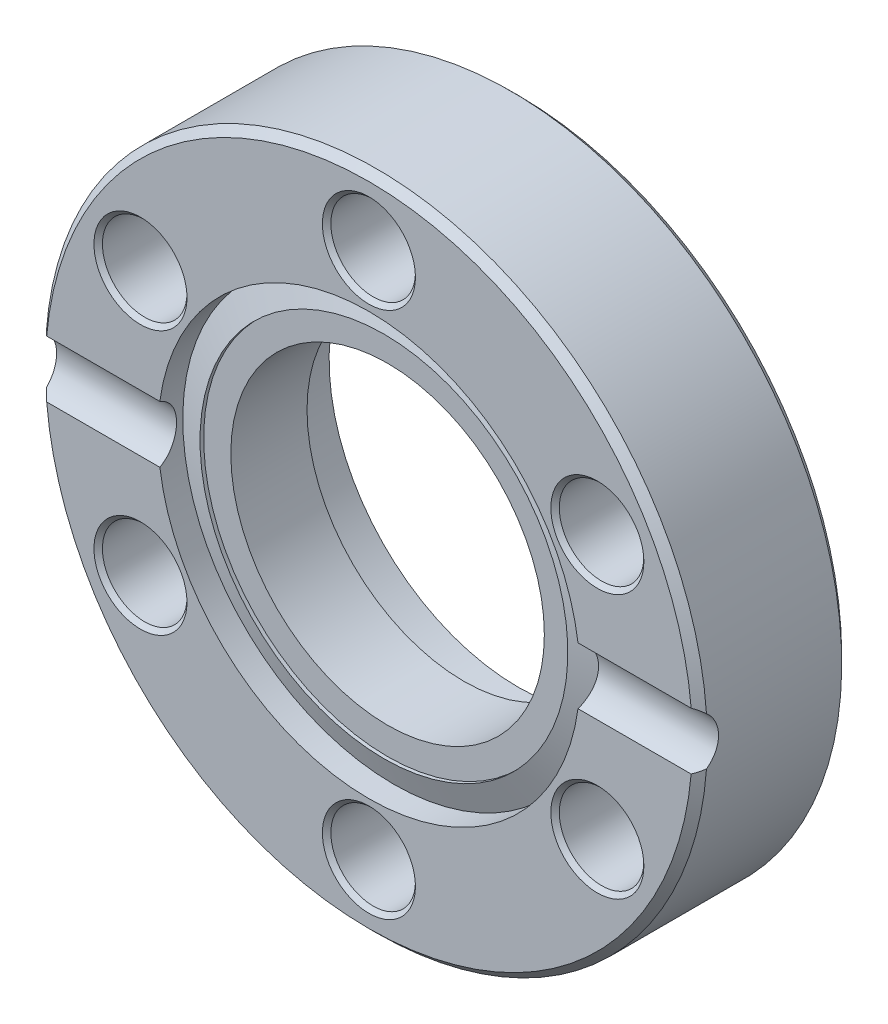
from build123d import *

# Parameters (mm, degrees)
SKETCH4_R          = 2.159
CUT_EXTRUDE1_DEPTH = 26.073415443
CUT_EXTRUDE2_START = 10.670865
SKETCH5_R          = 1.5875
CUT_EXTRUDE2_DEPTH = 6.220135


# Read off the part's stored shape, not the designer's step: Mirror2
with BuildPart() as part:
    # Sketch3 → Revolve1 (revolve)
    with BuildSketch(Plane(origin=(0, 0, 0), x_dir=(0, 0, -1), z_dir=(1, 0, 0)), mode=Mode.PRIVATE) as revolve1_sk:
        Polygon((-3.81, 16.51), (-3.81, 10.7696), (-2.54, 10.7696), (-3.043843995, 9.3853), (-2.8575, 9.3853), (-2.8575, 8.001), (1.031875, 8.001), (1.031875, 9.652), (3.81, 9.652), (3.81, 16.51), (3.429, 16.891), (-3.429, 16.891), align=None)
    revolve(revolve1_sk.sketch.rotate(Axis((0, 0, 3.81), (0, 0, -1)), 180), axis=Axis((0, 0, 3.81), (0, 0, -1)))

    # Sketch4 → Cut-Extrude1 (cut, through all)
    with BuildSketch(Plane.XY.offset(3.81)):
        with Locations((0, 13.462)):
            Circle(SKETCH4_R)
        with Locations((11.658433986, 6.731)):
            Circle(SKETCH4_R)
        with Locations((11.658433986, -6.731)):
            Circle(SKETCH4_R)
        with Locations((0, -13.462)):
            Circle(SKETCH4_R)
        with Locations((-11.658433986, -6.731)):
            Circle(SKETCH4_R)
        with Locations((-11.658433986, 6.731)):
            Circle(SKETCH4_R)
    extrude(amount=-CUT_EXTRUDE1_DEPTH, mode=Mode.SUBTRACT)

    # Sketch5 → Cut-Extrude2 (cut)
    with BuildSketch(Plane(origin=(0, 0, 0), x_dir=(0, 0, -1), z_dir=(1, 0, 0)).offset(CUT_EXTRUDE2_START)):
        with Locations((-4.445, 0)):
            Circle(SKETCH5_R)
    cut_extrude2 = extrude(amount=CUT_EXTRUDE2_DEPTH, mode=Mode.SUBTRACT)

    # Mirror1: Cut-Extrude2 across plane
    add(cut_extrude2.mirror(Plane(origin=(0, 0, 0), x_dir=(0, 0, 1), z_dir=(1, 0, 0))), mode=Mode.SUBTRACT)

    # Cut-Extrude3 cone 1 section (through the dimple's axis) → Cut-Extrude3 (revolve, cut)
    with BuildSketch(Plane(origin=(0, 13.462, 3.81), x_dir=(0, -1, 0), z_dir=(1, 0, 0))):
        Polygon((0, 0), (2.3749, 0), (0, 2.3749), align=None)
    revolve(axis=Axis((0, 13.462, 3.81), (0, 0, -1)), mode=Mode.SUBTRACT)

    # Cut-Extrude3 cone 2 section (through the dimple's axis) → Cut-Extrude3 cone 2 (revolve, cut)
    with BuildSketch(Plane(origin=(11.658433986, 6.731, 3.81), x_dir=(0, -1, 0), z_dir=(1, 0, 0))):
        Polygon((0, 0), (2.3749, 0), (0, 2.3749), align=None)
    revolve(axis=Axis((11.658433986, 6.731, 3.81), (0, 0, -1)), mode=Mode.SUBTRACT)

    # Cut-Extrude3 cone 3 section (through the dimple's axis) → Cut-Extrude3 cone 3 (revolve, cut)
    with BuildSketch(Plane(origin=(11.658433986, -6.731, 3.81), x_dir=(0, -1, 0), z_dir=(1, 0, 0))):
        Polygon((0, 0), (2.3749, 0), (0, 2.3749), align=None)
    revolve(axis=Axis((11.658433986, -6.731, 3.81), (0, 0, -1)), mode=Mode.SUBTRACT)

    # Cut-Extrude3 cone 4 section (through the dimple's axis) → Cut-Extrude3 cone 4 (revolve, cut)
    with BuildSketch(Plane(origin=(0, -13.462, 3.81), x_dir=(0, -1, 0), z_dir=(1, 0, 0))):
        Polygon((0, 0), (2.3749, 0), (0, 2.3749), align=None)
    revolve(axis=Axis((0, -13.462, 3.81), (0, 0, -1)), mode=Mode.SUBTRACT)

    # Cut-Extrude3 cone 5 section (through the dimple's axis) → Cut-Extrude3 cone 5 (revolve, cut)
    with BuildSketch(Plane(origin=(-11.658433986, -6.731, 3.81), x_dir=(0, -1, 0), z_dir=(1, 0, 0))):
        Polygon((0, 0), (2.3749, 0), (0, 2.3749), align=None)
    revolve(axis=Axis((-11.658433986, -6.731, 3.81), (0, 0, -1)), mode=Mode.SUBTRACT)

    # Cut-Extrude3 cone 6 section (through the dimple's axis) → Cut-Extrude3 cone 6 (revolve, cut)
    with BuildSketch(Plane(origin=(-11.658433986, 6.731, 3.81), x_dir=(0, -1, 0), z_dir=(1, 0, 0))):
        Polygon((0, 0), (2.3749, 0), (0, 2.3749), align=None)
    revolve(axis=Axis((-11.658433986, 6.731, 3.81), (0, 0, -1)), mode=Mode.SUBTRACT)

    # Mirror2 outline → Mirror2 (revolve, cut)
    with BuildSketch(Plane.XZ.offset(-13.462)):
        Polygon((2.3749, -3.81), (2.159, -3.5941), (2.159, -3.81), align=None)
    revolve(axis=Axis((0, 13.462, 0), (0, 0, 1)), mode=Mode.SUBTRACT)

    # Mirror2 2 outline → Mirror2 2 (revolve, cut)
    with BuildSketch(Plane(origin=(-11.658433986, 6.731, 0), x_dir=(1, 0, 0), z_dir=(0, -1, 0))):
        Polygon((2.3749, -3.81), (2.159, -3.5941), (2.159, -3.81), align=None)
    revolve(axis=Axis((-11.658433986, 6.731, 0), (0, 0, 1)), mode=Mode.SUBTRACT)

    # Mirror2 3 outline → Mirror2 3 (revolve, cut)
    with BuildSketch(Plane(origin=(-11.658433986, -6.731, 0), x_dir=(1, 0, 0), z_dir=(0, -1, 0))):
        Polygon((2.3749, -3.81), (2.159, -3.5941), (2.159, -3.81), align=None)
    revolve(axis=Axis((-11.658433986, -6.731, 0), (0, 0, 1)), mode=Mode.SUBTRACT)

    # Mirror2 4 outline → Mirror2 4 (revolve, cut)
    with BuildSketch(Plane.XZ.offset(13.462)):
        Polygon((2.3749, -3.81), (2.159, -3.5941), (2.159, -3.81), align=None)
    revolve(axis=Axis((0, -13.462, 0), (0, 0, 1)), mode=Mode.SUBTRACT)

    # Mirror2 5 outline → Mirror2 5 (revolve, cut)
    with BuildSketch(Plane(origin=(11.658433986, -6.731, 0), x_dir=(1, 0, 0), z_dir=(0, -1, 0))):
        Polygon((2.3749, -3.81), (2.159, -3.5941), (2.159, -3.81), align=None)
    revolve(axis=Axis((11.658433986, -6.731, 0), (0, 0, 1)), mode=Mode.SUBTRACT)

    # Mirror2 6 outline → Mirror2 6 (revolve, cut)
    with BuildSketch(Plane(origin=(11.658433986, 6.731, 0), x_dir=(1, 0, 0), z_dir=(0, -1, 0))):
        Polygon((2.3749, -3.81), (2.159, -3.5941), (2.159, -3.81), align=None)
    revolve(axis=Axis((11.658433986, 6.731, 0), (0, 0, 1)), mode=Mode.SUBTRACT)


solid = part.part
